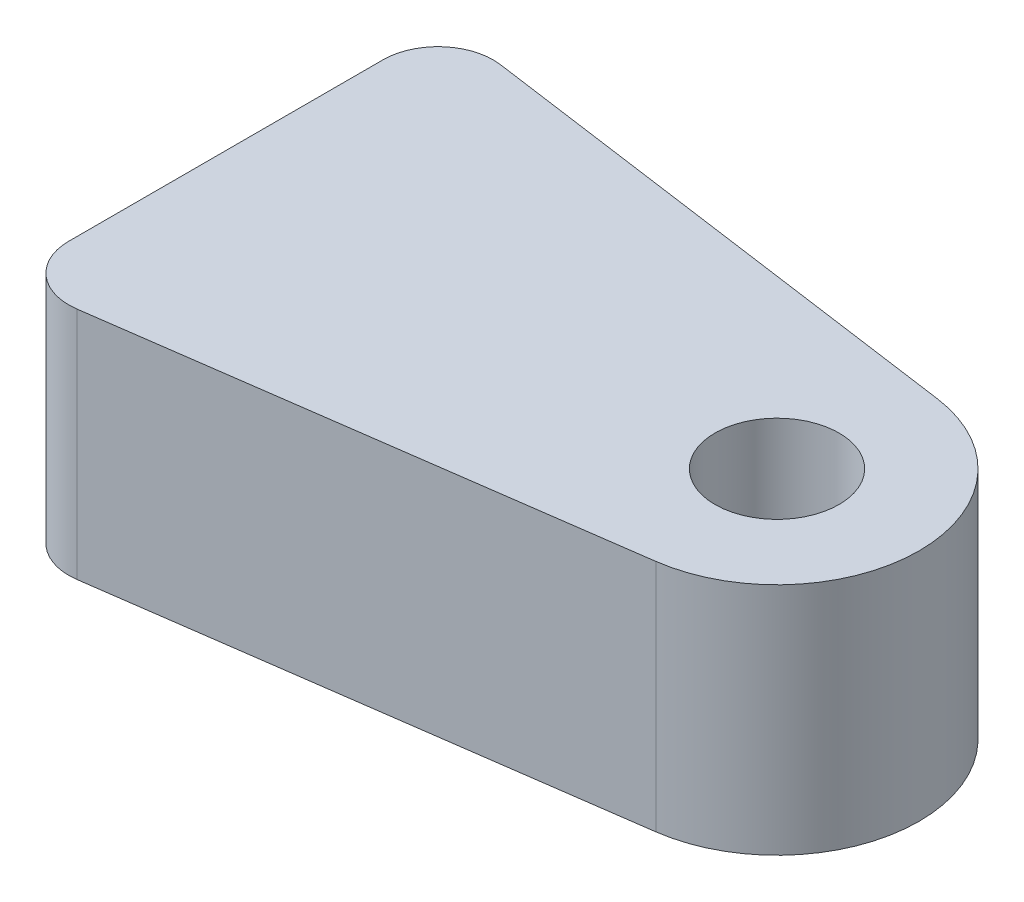
from build123d import *

# Parameters (mm, degrees)
ESQUISSE1_R             = 5.158029836
ESQUISSE1_R_2           = 2.45
BOSS_EXTRU_1_DEPTH      = 2.5
ESQUISSE2_R             = 5.158029836
ESQUISSE2_R_2           = 1
BOSS_EXTRU_2_DEPTH      = 6
ESQUISSE3_R             = 2.25
ENL_V_MAT_EXTRU_1_DEPTH = 4.5
BOSS_EXTRU_3_DEPTH      = 8.5
CONG_1_R                = 2


with BuildPart() as part:
    # Esquisse1 → Boss.-Extru.1 (new body)
    with BuildSketch(Plane(origin=(0, 0, 0), x_dir=(1, 0, 0), z_dir=(0, 1, 0))):
        Circle(ESQUISSE1_R)
        Circle(ESQUISSE1_R_2, mode=Mode.SUBTRACT)
    extrude(amount=BOSS_EXTRU_1_DEPTH)

    # Esquisse2 → Boss.-Extru.2 (add)
    with BuildSketch(Plane(origin=(0, 2.5, 0), x_dir=(1, 0, 0), z_dir=(0, 1, 0))):
        Circle(ESQUISSE2_R)
        Circle(ESQUISSE2_R_2, mode=Mode.SUBTRACT)
    extrude(amount=BOSS_EXTRU_2_DEPTH)

    # Esquisse3 → Enlèv. mat.-Extru.1 (cut)
    with BuildSketch(Plane(origin=(0, 8.5, 0), x_dir=(1, 0, 0), z_dir=(0, 1, 0))):
        Circle(ESQUISSE3_R)
    extrude(amount=-ENL_V_MAT_EXTRU_1_DEPTH, mode=Mode.SUBTRACT)

    # Esquisse4 → Boss.-Extru.3 (add)
    with BuildSketch(Plane(origin=(0, 0, 0), x_dir=(1, 0, 0), z_dir=(0, 1, 0))):
        Polygon((0.713134037, 5.108494067), (-20, 8), (-20, -8), (0.713134037, -5.108494067), (-2.684753976, -2.73597438), (-2.684753976, 1.689272532), align=None)
    extrude(amount=BOSS_EXTRU_3_DEPTH)

    # Congé1
    cong_1_edges = [part.edges().sort_by_distance(p)[0] for p in [
        (-20, 4.25, 8),
        (-20, 4.25, -8),
    ]]
    fillet(cong_1_edges, radius=CONG_1_R)


solid = part.part
